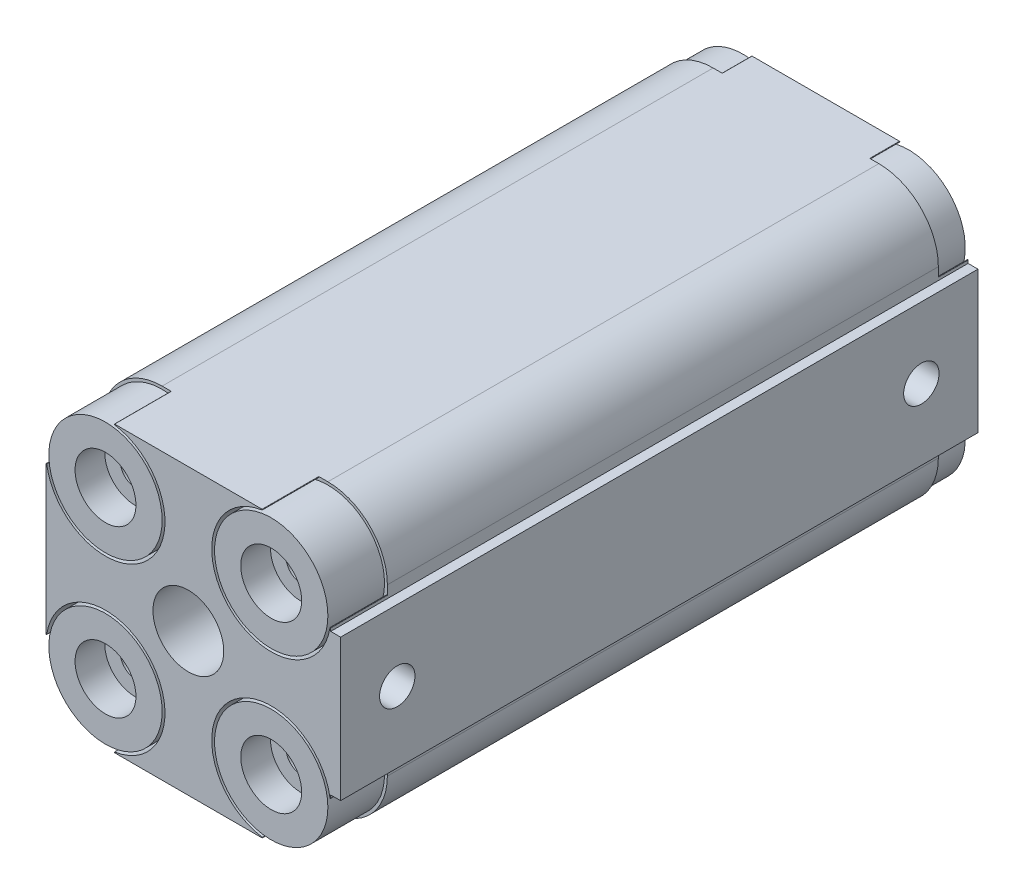
from build123d import *

# Parameters (mm, degrees)
SKETCH1_R           = 2.1
BOSS_EXTRUDE1_DEPTH = 90
SKETCH5_R           = 2.5
CUT_EXTRUDE1_DEPTH  = 5
SKETCH6_R           = 8.4
SKETCH6_R_2         = 8
CUT_EXTRUDE2_DEPTH  = 4.2
FILLET1_START       = -1
FILLET1_DEPTH       = 5.2
CUT_EXTRUDE3_START  = -8
SKETCH7_R           = 8.4
SKETCH7_R_2         = 8
CUT_EXTRUDE3_DEPTH  = 8
SKETCH8_R           = 4.3
CUT_EXTRUDE4_DEPTH  = 4.2
FILLET2_START       = 82
FILLET2_DEPTH       = 9
SKETCH9_R           = 5
CUT_EXTRUDE5_DEPTH  = 85.8
SKETCH10_R          = 4.2
CUT_EXTRUDE6_DEPTH  = 4.2
BOSS_EXTRUDE2_START = 1.4
SKETCH11_W          = 90
SKETCH11_H          = 20
SKETCH11_R          = 2.5
BOSS_EXTRUDE2_DEPTH = 1.4


with BuildPart() as part:
    # Sketch1 → Boss-Extrude1 (new body)
    with BuildSketch(Plane.XY):
        with BuildLine():
            Line((8.4, 0), (31.8, 0))
            ThreePointArc((31.8, 0), (37.739696962, 2.460303038), (40.2, 8.4))
            Line((40.2, 8.4), (40.2, 31.8))
            ThreePointArc((40.2, 31.8), (37.739696962, 37.739696962), (31.8, 40.2))
            Line((31.8, 40.2), (8.4, 40.2))
            ThreePointArc((8.4, 40.2), (2.460303038, 37.739696962), (0, 31.8))
            Line((0, 31.8), (0, 8.4))
            ThreePointArc((0, 8.4), (2.460303038, 2.460303038), (8.4, 0))
        make_face()
        with Locations(Location((8.4, 31.8, 0), (0, 0, 180))):
            Circle(SKETCH1_R, mode=Mode.SUBTRACT)
        with Locations(Location((31.8, 31.8, 0), (0, 0, 180))):
            Circle(SKETCH1_R, mode=Mode.SUBTRACT)
        with Locations(Location((31.8, 8.4, 0), (0, 0, 180))):
            Circle(SKETCH1_R, mode=Mode.SUBTRACT)
        with Locations(Location((8.4, 8.4, 0), (0, 0, 180))):
            Circle(SKETCH1_R, mode=Mode.SUBTRACT)
    extrude(amount=BOSS_EXTRUDE1_DEPTH)

    # Sketch5 → Cut-Extrude1 (cut)
    with BuildSketch(Plane(origin=(40.2, 0, 0), x_dir=(0, 0, -1), z_dir=(1, 0, 0))):
        with Locations((-82, 20.1)):
            Circle(SKETCH5_R)
        with Locations((-8, 20.1)):
            Circle(SKETCH5_R)
    extrude(amount=-CUT_EXTRUDE1_DEPTH, mode=Mode.SUBTRACT)

    # Sketch6 → Cut-Extrude2 (cut)
    # profile 1 of 4: a face of its own
    with BuildSketch(Plane(origin=(0, 0, 0), x_dir=(-1, 0, 0), z_dir=(0, 0, -1))):
        with Locations((-31.8, 31.8)):
            Circle(SKETCH6_R)
        with Locations((-31.8, 31.8)):
            Circle(SKETCH6_R_2, mode=Mode.SUBTRACT)
    # profile 2 of 4: a face of its own
    with BuildSketch(Plane(origin=(0, 0, 0), x_dir=(-1, 0, 0), z_dir=(0, 0, -1))):
        with Locations((-8.4, 31.8)):
            Circle(SKETCH6_R)
        with Locations((-8.4, 31.8)):
            Circle(SKETCH6_R_2, mode=Mode.SUBTRACT)
    # profile 3 of 4: a face of its own
    with BuildSketch(Plane(origin=(0, 0, 0), x_dir=(-1, 0, 0), z_dir=(0, 0, -1))):
        with Locations((-8.4, 8.4)):
            Circle(SKETCH6_R)
        with Locations((-8.4, 8.4)):
            Circle(SKETCH6_R_2, mode=Mode.SUBTRACT)
    # profile 4 of 4: a face of its own
    with BuildSketch(Plane(origin=(0, 0, 0), x_dir=(-1, 0, 0), z_dir=(0, 0, -1))):
        with Locations((-31.8, 8.4)):
            Circle(SKETCH6_R)
        with Locations((-31.8, 8.4)):
            Circle(SKETCH6_R_2, mode=Mode.SUBTRACT)
    extrude(amount=-CUT_EXTRUDE2_DEPTH, mode=Mode.SUBTRACT)

    # Fillet1: read off the stored shape, not the designer's step
    # Fillet1 outline → Fillet1 (cut)
    with BuildSketch(Plane.XY.offset(FILLET1_START)):
        with BuildLine():
            ThreePointArc((0, 8.4), (0.024888944, 9.046153846), (0.099408284, 9.688478624))
            ThreePointArc((0.099408284, 9.688478624), (0.046153846, 9.646296288), (0, 9.69614814))
            Line((0, 9.69614814), (0, 8.4))
        make_face()
        with BuildLine():
            ThreePointArc((9.69614814, 0), (9.646296288, 0.046153846), (9.688478624, 0.099408284))
            ThreePointArc((9.688478624, 0.099408284), (9.046153846, 0.024888944), (8.4, 0))
            Line((8.4, 0), (9.69614814, 0))
        make_face()
        with BuildLine():
            Line((0, 31.8), (0, 30.50385186))
            ThreePointArc((0, 30.50385186), (0.046153846, 30.553703712), (0.099408284, 30.511521376))
            ThreePointArc((0.099408284, 30.511521376), (0.024888944, 31.153846154), (0, 31.8))
        make_face()
        with BuildLine():
            ThreePointArc((30.511521376, 0.099408284), (30.553703712, 0.046153846), (30.50385186, 0))
            Line((30.50385186, 0), (31.8, 0))
            ThreePointArc((31.8, 0), (31.153846154, 0.024888944), (30.511521376, 0.099408284))
        make_face()
        with BuildLine():
            ThreePointArc((8.4, 40.2), (9.046153846, 40.175111056), (9.688478624, 40.100591716))
            ThreePointArc((9.688478624, 40.100591716), (9.646296288, 40.153846154), (9.69614814, 40.2))
            Line((9.69614814, 40.2), (8.4, 40.2))
        make_face()
        with BuildLine():
            ThreePointArc((40.2, 9.69614814), (40.153846154, 9.646296288), (40.100591716, 9.688478624))
            ThreePointArc((40.100591716, 9.688478624), (40.175111056, 9.046153846), (40.2, 8.4))
            Line((40.2, 8.4), (40.2, 9.69614814))
        make_face()
        with BuildLine():
            Line((31.8, 40.2), (30.50385186, 40.2))
            ThreePointArc((30.50385186, 40.2), (30.553703712, 40.153846154), (30.511521376, 40.100591716))
            ThreePointArc((30.511521376, 40.100591716), (31.153846154, 40.175111056), (31.8, 40.2))
        make_face()
        with BuildLine():
            ThreePointArc((40.100591716, 30.511521376), (40.153846154, 30.553703712), (40.2, 30.50385186))
            Line((40.2, 30.50385186), (40.2, 31.8))
            ThreePointArc((40.2, 31.8), (40.175111056, 31.153846154), (40.100591716, 30.511521376))
        make_face()
    extrude(amount=FILLET1_DEPTH, mode=Mode.SUBTRACT)

    # Sketch7 → Cut-Extrude3 (cut)
    # profile 1 of 4: a face of its own
    with BuildSketch(Plane.XY.offset(90).offset(CUT_EXTRUDE3_START)):
        with Locations((8.4, 31.8)):
            Circle(SKETCH7_R)
        with Locations(Location((8.4, 31.8, 0), (0, 0, 180))):
            Circle(SKETCH7_R_2, mode=Mode.SUBTRACT)
    # profile 2 of 4: a face of its own
    with BuildSketch(Plane.XY.offset(90).offset(CUT_EXTRUDE3_START)):
        with Locations((31.8, 31.8)):
            Circle(SKETCH7_R)
        with Locations(Location((31.8, 31.8, 0), (0, 0, 180))):
            Circle(SKETCH7_R_2, mode=Mode.SUBTRACT)
    # profile 3 of 4: a face of its own
    with BuildSketch(Plane.XY.offset(90).offset(CUT_EXTRUDE3_START)):
        with Locations((31.8, 8.4)):
            Circle(SKETCH7_R)
        with Locations(Location((31.8, 8.4, 0), (0, 0, 180))):
            Circle(SKETCH7_R_2, mode=Mode.SUBTRACT)
    # profile 4 of 4: a face of its own
    with BuildSketch(Plane.XY.offset(90).offset(CUT_EXTRUDE3_START)):
        with Locations((8.4, 8.4)):
            Circle(SKETCH7_R)
        with Locations(Location((8.4, 8.4, 0), (0, 0, 180))):
            Circle(SKETCH7_R_2, mode=Mode.SUBTRACT)
    extrude(amount=CUT_EXTRUDE3_DEPTH, mode=Mode.SUBTRACT)

    # Sketch8 → Cut-Extrude4 (cut)
    with BuildSketch(Plane.XY.offset(90)):
        with Locations((8.4, 31.8)):
            Circle(SKETCH8_R)
        with Locations((31.8, 31.8)):
            Circle(SKETCH8_R)
        with Locations((31.8, 8.4)):
            Circle(SKETCH8_R)
        with Locations((8.4, 8.4)):
            Circle(SKETCH8_R)
    extrude(amount=-CUT_EXTRUDE4_DEPTH, mode=Mode.SUBTRACT)

    # Fillet2: read off the stored shape, not the designer's step
    # Fillet2 outline → Fillet2 (cut)
    with BuildSketch(Plane.XY.offset(FILLET2_START)):
        with BuildLine():
            ThreePointArc((0.099408284, 9.688478624), (0.046153846, 9.646296288), (0, 9.69614814))
            Line((0, 9.69614814), (0, 8.4))
            ThreePointArc((0, 8.4), (0.024888944, 9.046153846), (0.099408284, 9.688478624))
        make_face()
        with BuildLine():
            Line((0, 31.8), (0, 30.50385186))
            ThreePointArc((0, 30.50385186), (0.046153846, 30.553703712), (0.099408284, 30.511521376))
            ThreePointArc((0.099408284, 30.511521376), (0.024888944, 31.153846154), (0, 31.8))
        make_face()
        with BuildLine():
            ThreePointArc((9.69614814, 0), (9.646296288, 0.046153846), (9.688478624, 0.099408284))
            ThreePointArc((9.688478624, 0.099408284), (9.046153846, 0.024888944), (8.4, 0))
            Line((8.4, 0), (9.69614814, 0))
        make_face()
        with BuildLine():
            ThreePointArc((8.4, 40.2), (9.046153846, 40.175111056), (9.688478624, 40.100591716))
            ThreePointArc((9.688478624, 40.100591716), (9.646296288, 40.153846154), (9.69614814, 40.2))
            Line((9.69614814, 40.2), (8.4, 40.2))
        make_face()
        with BuildLine():
            ThreePointArc((30.511521376, 0.099408284), (30.553703712, 0.046153846), (30.50385186, 0))
            Line((30.50385186, 0), (31.8, 0))
            ThreePointArc((31.8, 0), (31.153846154, 0.024888944), (30.511521376, 0.099408284))
        make_face()
        with BuildLine():
            Line((31.8, 40.2), (30.50385186, 40.2))
            ThreePointArc((30.50385186, 40.2), (30.553703712, 40.153846154), (30.511521376, 40.100591716))
            ThreePointArc((30.511521376, 40.100591716), (31.153846154, 40.175111056), (31.8, 40.2))
        make_face()
        with BuildLine():
            ThreePointArc((40.2, 9.69614814), (40.153846154, 9.646296288), (40.100591716, 9.688478624))
            ThreePointArc((40.100591716, 9.688478624), (40.175111056, 9.046153846), (40.2, 8.4))
            Line((40.2, 8.4), (40.2, 9.69614814))
        make_face()
        with BuildLine():
            ThreePointArc((40.2, 31.8), (40.175111056, 31.153846154), (40.100591716, 30.511521376))
            ThreePointArc((40.100591716, 30.511521376), (40.153846154, 30.553703712), (40.2, 30.50385186))
            Line((40.2, 30.50385186), (40.2, 31.8))
        make_face()
    extrude(amount=FILLET2_DEPTH, mode=Mode.SUBTRACT)

    # Sketch9 → Cut-Extrude5 (cut)
    with BuildSketch(Plane.XY.offset(90)):
        with Locations((20.1, 20.1)):
            Circle(SKETCH9_R)
    extrude(amount=-CUT_EXTRUDE5_DEPTH, mode=Mode.SUBTRACT)

    # Sketch10 → Cut-Extrude6 (cut)
    with BuildSketch(Plane(origin=(0, 0, 0), x_dir=(-1, 0, 0), z_dir=(0, 0, -1))):
        with Locations((-31.8, 31.8)):
            Circle(SKETCH10_R)
        with Locations((-8.4, 31.8)):
            Circle(SKETCH10_R)
        with Locations((-31.8, 8.4)):
            Circle(SKETCH10_R)
        with Locations((-8.4, 8.4)):
            Circle(SKETCH10_R)
    extrude(amount=-CUT_EXTRUDE6_DEPTH, mode=Mode.SUBTRACT)

    # Sketch11 → Boss-Extrude2 (add)
    with BuildSketch(Plane(origin=(40.2, 0, 0), x_dir=(0, 0, -1), z_dir=(1, 0, 0)).offset(BOSS_EXTRUDE2_START)):
        with Locations((-45, 20.1)):
            Rectangle(SKETCH11_W, SKETCH11_H)
        with Locations((-82, 20.1)):
            Circle(SKETCH11_R, mode=Mode.SUBTRACT)
        with Locations((-8, 20.1)):
            Circle(SKETCH11_R, mode=Mode.SUBTRACT)
    extrude(amount=-BOSS_EXTRUDE2_DEPTH)


solid = part.part
